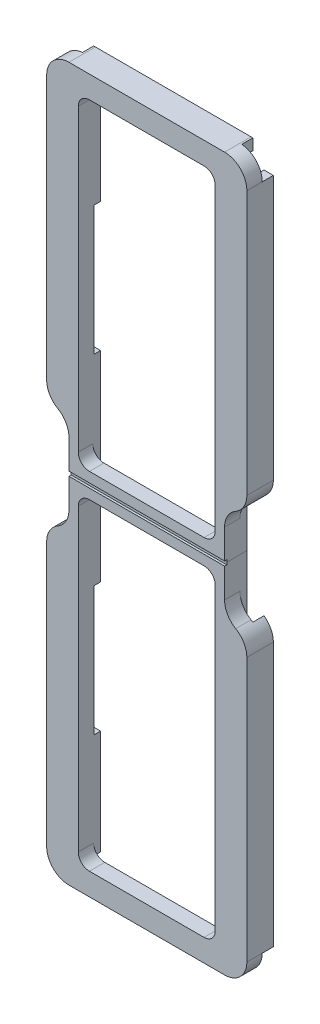
from build123d import *

# Parameters (mm, degrees)
SKETCH1_W            = 300
SKETCH1_H            = 4.2
BOSS_EXTRUDE1_DEPTH  = 5
SKETCH3_W            = 4.2
SKETCH3_H            = 58
CUT_EXTRUDE1_DEPTH   = 280.318535117
SKETCH4_W            = 2.1
SKETCH4_H            = 1.5
SKETCH4_W_2          = 1.15
SKETCH4_H_2          = 0.57
BOSS_EXTRUDE2_DEPTH  = 58
SKETCH5_W            = 4.2
SKETCH5_H            = 1.9
BOSS_EXTRUDE3_DEPTH  = 5
SKETCH6_W            = 5
SKETCH6_H            = 1.9
BOSS_EXTRUDE4_DEPTH  = 63
SKETCH7_W            = 5
SKETCH7_H            = 1.9
BOSS_EXTRUDE5_DEPTH  = 63
SKETCH8_W            = 5
SKETCH8_H            = 1.5
BOSS_EXTRUDE6_DEPTH  = 63
FILLET1_R            = 5
SKETCH9_W            = 69.9
SKETCH9_H            = 2
CUT_EXTRUDE2_DEPTH   = 1
SKETCH11_W           = 61.5
SKETCH11_H           = 147.5
BOSS_EXTRUDE8_DEPTH  = 5
SKETCH12_W           = 69.9
SKETCH12_H           = 2
BOSS_EXTRUDE9_DEPTH  = 5
SKETCH13_W           = 61.5
SKETCH13_H           = 147.5
BOSS_EXTRUDE10_DEPTH = 5
SKETCH15_W           = 125.83484861
SKETCH15_H           = 6.9
BOSS_EXTRUDE11_DEPTH = 10
SKETCH16_W           = 125.83484861
SKETCH16_H           = 6.9
BOSS_EXTRUDE12_DEPTH = 10
SKETCH17_W           = 10
SKETCH17_H           = 6.9
BOSS_EXTRUDE13_DEPTH = 5
BOSS_EXTRUDE14_REACH = 297.377
SKETCH18_W           = 4.47029548
SKETCH18_H           = 6.9
SKETCH19_W           = 10
SKETCH19_H           = 6.9
BOSS_EXTRUDE15_DEPTH = 5
SKETCH20_W           = 5
SKETCH20_H           = 6.9
BOSS_EXTRUDE16_DEPTH = 79.9
SKETCH21_W           = 89.9
SKETCH21_H           = 6.9
BOSS_EXTRUDE17_DEPTH = 5
SKETCH22_W           = 89.9
SKETCH22_H           = 6.9
BOSS_EXTRUDE18_DEPTH = 5
SKETCH23_W           = 4.2
SKETCH23_H           = 125.83484861
SKETCH23_W_2         = 71.5
SKETCH23_H_2         = 5
BOSS_EXTRUDE19_DEPTH = 5
SKETCH24_W           = 4.2
SKETCH24_H           = 125.83484861
SKETCH24_W_2         = 71.5
SKETCH24_H_2         = 5
BOSS_EXTRUDE20_DEPTH = 5
FILLET2_R            = 10
FILLET3_R            = 10
FILLET4_R            = 10
SKETCH25_W           = 61.5
SKETCH25_H           = 6.5
BOSS_EXTRUDE21_DEPTH = 3
SKETCH26_W           = 61.5
SKETCH26_H           = 6.5
BOSS_EXTRUDE22_DEPTH = 3
FILLET5_R            = 5


with BuildPart() as part:
    # Sketch1 → Boss-Extrude1 (new body)
    with BuildSketch(Plane(origin=(0, 0, 0), x_dir=(0, 1, 0), z_dir=(0, 0, 1))):
        with Locations((129.189144184, 4.775014868)):
            Rectangle(SKETCH1_W, SKETCH1_H)
    extrude(amount=BOSS_EXTRUDE1_DEPTH)

    # Sketch3 → Cut-Extrude1 (cut, through all)
    with BuildSketch(Plane.XY.offset(5)):
        with Locations((-4.775014868, 55.189144184)):
            Rectangle(SKETCH3_W, SKETCH3_H)
    extrude(amount=-CUT_EXTRUDE1_DEPTH, mode=Mode.SUBTRACT)


with BuildPart() as cut_extrude1_piece_1:
    # of the separate pieces the step leaves, piece 1, a body of its own (cut_extrude1_pieces)
    add(part.part.solids().sort_by_distance((-6.875014868, 84.189144184, 0))[0])



with BuildPart() as cut_extrude1_piece_2:
    # of the separate pieces the step leaves, piece 2, a body of its own (cut_extrude1_pieces)
    add(part.part.solids().sort_by_distance((-6.875014868, -20.810855816, 0))[0])


with BuildPart() as cut_extrude1_piece_1_1:
    add(cut_extrude1_piece_1.part)

    add(cut_extrude1_piece_2.part)  # Boss-Extrude2 merges Cut-Extrude1 piece 2
    # Sketch4 → Boss-Extrude2 (add)
    with BuildSketch(Plane.XZ.offset(-84.189144184)):
        Polygon((-5.925014868, 5), (-6.875014868, 5), (-6.875014868, 2.93), (-5.925014868, 2.93), (-5.925014868, 3.5), align=None)
        with Locations((-4.875014868, 4.25)):
            Rectangle(SKETCH4_W, SKETCH4_H)
        with Locations((-3.250014868, 4.25)):
            Rectangle(SKETCH4_W_2, SKETCH4_H)
        with Locations((-3.250014868, 3.215)):
            Rectangle(SKETCH4_W_2, SKETCH4_H_2)
    extrude(amount=BOSS_EXTRUDE2_DEPTH)

    # Split1
    split(bisect_by=Plane(origin=(0, 129.189144184, 0), x_dir=(1, 0, 0), z_dir=(0, 1, 0)), keep=Keep.BOTTOM)

    # Sketch5 → Boss-Extrude3 (add)
    with BuildSketch(Plane.XZ.offset(20.810855816)):
        with Locations((-4.775014868, 4.05)):
            Rectangle(SKETCH5_W, SKETCH5_H)
    extrude(amount=BOSS_EXTRUDE3_DEPTH)

    # Mirror1: Cut-Extrude1 piece 1 across plane


with BuildPart() as cut_extrude1_piece_1_2:
    add(cut_extrude1_piece_1_1.part)
    add(cut_extrude1_piece_1_1.part.mirror(Plane.ZX.offset(129.189144184)))


with BuildPart() as body_2:
    # Mirror4: mirrored copy
    add(cut_extrude1_piece_1_2.part.mirror(Plane.ZY.offset(-28.074985132)))


with BuildPart() as cut_extrude1_piece_1_3:
    add(cut_extrude1_piece_1_2.part)

    add(body_2.part)  # Boss-Extrude4 merges body 2
    # Sketch6 → Boss-Extrude4 (add)
    with BuildSketch(Plane.YZ.offset(-2.675014868)):
        with Locations((-23.310855816, 4.05)):
            Rectangle(SKETCH6_W, SKETCH6_H)
    extrude(amount=BOSS_EXTRUDE4_DEPTH)

    # Sketch7 → Boss-Extrude5 (add)
    with BuildSketch(Plane.YZ.offset(-2.675014868)):
        with Locations((281.689144184, 4.05)):
            Rectangle(SKETCH7_W, SKETCH7_H)
    extrude(amount=BOSS_EXTRUDE5_DEPTH)

    # Sketch8 → Boss-Extrude6 (add)
    with BuildSketch(Plane.YZ.offset(-2.675014868)):
        with Locations((129.189144184, 4.25)):
            Rectangle(SKETCH8_W, SKETCH8_H)
    extrude(amount=BOSS_EXTRUDE6_DEPTH)

    # Fillet1
    fillet1_edges = [cut_extrude1_piece_1_3.edges().sort_by_distance(p)[0] for p in [
        (63.024985132, 284.189144184, 4.05),
        (-6.875014868, -25.810855816, 4.05),
        (-6.875014868, 284.189144184, 4.05),
        (63.024985132, -25.810855816, 4.05),
    ]]
    fillet(fillet1_edges, radius=FILLET1_R)

    # Sketch9 → Cut-Extrude2 (cut)
    with BuildSketch(Plane.XY.offset(5)):
        with Locations((28.074985132, 129.189144184)):
            Rectangle(SKETCH9_W, SKETCH9_H)
    extrude(amount=-CUT_EXTRUDE2_DEPTH, mode=Mode.SUBTRACT)

    # Sketch11 → Boss-Extrude8 (add)
    with BuildSketch(Plane.XY.offset(5)):
        with BuildLine():
            Line((58.024985132, 284.189144184), (-1.875014868, 284.189144184))
            ThreePointArc((-1.875014868, 284.189144184), (-5.410548774, 282.72467809), (-6.875014868, 279.189144184))
            Line((-6.875014868, 279.189144184), (-6.875014868, 130.189144184))
            Line((-6.875014868, 130.189144184), (63.024985132, 130.189144184))
            Line((63.024985132, 130.189144184), (63.024985132, 279.189144184))
            ThreePointArc((63.024985132, 279.189144184), (61.560519038, 282.72467809), (58.024985132, 284.189144184))
        make_face()
        with Locations((28.074985132, 205.439144184)):
            Rectangle(SKETCH11_W, SKETCH11_H, mode=Mode.SUBTRACT)
    extrude(amount=BOSS_EXTRUDE8_DEPTH)

    # Sketch12 → Boss-Extrude9 (add)
    with BuildSketch(Plane.XY.offset(4)):
        with Locations((28.074985132, 129.189144184)):
            Rectangle(SKETCH12_W, SKETCH12_H)
    extrude(amount=BOSS_EXTRUDE9_DEPTH)

    # Sketch13 → Boss-Extrude10 (add)
    with BuildSketch(Plane.XY.offset(5)):
        with BuildLine():
            Line((63.024985132, -20.810855816), (63.024985132, 128.189144184))
            Line((63.024985132, 128.189144184), (-6.875014868, 128.189144184))
            Line((-6.875014868, 128.189144184), (-6.875014868, -20.810855816))
            ThreePointArc((-6.875014868, -20.810855816), (-5.410548774, -24.346389722), (-1.875014868, -25.810855816))
            Line((-1.875014868, -25.810855816), (58.024985132, -25.810855816))
            ThreePointArc((58.024985132, -25.810855816), (61.560519038, -24.346389722), (63.024985132, -20.810855816))
        make_face()
        with Locations((28.074985132, 52.939144184)):
            Rectangle(SKETCH13_W, SKETCH13_H, mode=Mode.SUBTRACT)
    extrude(amount=BOSS_EXTRUDE10_DEPTH)

    # Sketch15 → Boss-Extrude11 (add)
    with BuildSketch(Plane.YZ.offset(63.024985132)):
        with Locations((216.271719879, 6.55)):
            Rectangle(SKETCH15_W, SKETCH15_H)
        with Locations((42.106568489, 6.55)):
            Rectangle(SKETCH15_W, SKETCH15_H)
    extrude(amount=BOSS_EXTRUDE11_DEPTH)

    # Sketch16 → Boss-Extrude12 (add)
    with BuildSketch(Plane(origin=(-6.875014868, 0, 0), x_dir=(0, -1, 0), z_dir=(-1, 0, 0))):
        with Locations((-216.271719879, 6.55)):
            Rectangle(SKETCH16_W, SKETCH16_H)
        with Locations((-42.106568489, 6.55)):
            Rectangle(SKETCH16_W, SKETCH16_H)
    extrude(amount=BOSS_EXTRUDE12_DEPTH)

    # Sketch17 → Boss-Extrude13 (add)
    with BuildSketch(Plane(origin=(0, 279.189144184, 0), x_dir=(-1, 0, 0), z_dir=(0, 1, 0))):
        with Locations((11.875014868, 6.55)):
            Rectangle(SKETCH17_W, SKETCH17_H)
        with Locations((-68.024985132, 6.55)):
            Rectangle(SKETCH17_W, SKETCH17_H)
    extrude(amount=BOSS_EXTRUDE13_DEPTH)

    # Boss-Extrude14: up to this face of the body (flat: up to its plane)
    boss_extrude14_end = Plane(cut_extrude1_piece_1_3.part.faces().sort_by_distance((63.024985132, 281.689144184, 6.55))[0])
    # Sketch18 → Boss-Extrude14 (add, up to the picked face)
    with BuildSketch(Plane.YZ.offset(-6.875014868), mode=Mode.PRIVATE) as boss_extrude14_sk1:
        with Locations((281.953996444, 6.55)):
            Rectangle(SKETCH18_W, SKETCH18_H)
    boss_extrude14_tool1 = split(extrude(boss_extrude14_sk1.sketch, amount=BOSS_EXTRUDE14_REACH, mode=Mode.PRIVATE), bisect_by=boss_extrude14_end, keep=Keep.BOTH, mode=Mode.PRIVATE)
    add(boss_extrude14_tool1.solids().sort_by(Axis((-6.875015, 281.953996, 6.55), (1, 0, 0)))[0])

    # Sketch19 → Boss-Extrude15 (add)
    with BuildSketch(Plane.XZ.offset(20.810855816)):
        with Locations((68.024985132, 6.55)):
            Rectangle(SKETCH19_W, SKETCH19_H)
    extrude(amount=BOSS_EXTRUDE15_DEPTH)

    # Sketch20 → Boss-Extrude16 (add)
    with BuildSketch(Plane(origin=(63.024985132, 0, 0), x_dir=(0, -1, 0), z_dir=(-1, 0, 0))):
        with Locations((23.310855816, 6.55)):
            Rectangle(SKETCH20_W, SKETCH20_H)
    extrude(amount=BOSS_EXTRUDE16_DEPTH)

    # Sketch21 → Boss-Extrude17 (add)
    with BuildSketch(Plane.XZ.offset(25.810855816)):
        with Locations((28.074985132, 6.55)):
            Rectangle(SKETCH21_W, SKETCH21_H)
    extrude(amount=BOSS_EXTRUDE17_DEPTH)

    # Sketch22 → Boss-Extrude18 (add)
    with BuildSketch(Plane(origin=(0, 284.189144184, 0), x_dir=(-1, 0, 0), z_dir=(0, 1, 0))):
        with Locations((-28.074985132, 6.55)):
            Rectangle(SKETCH22_W, SKETCH22_H)
    extrude(amount=BOSS_EXTRUDE18_DEPTH)

    # Sketch23 → Boss-Extrude19 (add)
    with BuildSketch(Plane(origin=(0, 0, 3.1), x_dir=(1, 0, 0), z_dir=(0, 0, -1))):
        with Locations((-14.775014868, -216.271719879)):
            Rectangle(SKETCH23_W, SKETCH23_H)
        with Locations((28.074985132, -286.689144184)):
            Rectangle(SKETCH23_W_2, SKETCH23_H_2)
        with Locations((70.924985132, -216.271719879)):
            Rectangle(SKETCH23_W, SKETCH23_H)
    extrude(amount=BOSS_EXTRUDE19_DEPTH)

    # Sketch24 → Boss-Extrude20 (add)
    with BuildSketch(Plane(origin=(0, 0, 3.1), x_dir=(1, 0, 0), z_dir=(0, 0, -1))):
        with Locations((-14.775014868, -42.106568489)):
            Rectangle(SKETCH24_W, SKETCH24_H)
        with Locations((70.924985132, -42.106568489)):
            Rectangle(SKETCH24_W, SKETCH24_H)
        with Locations((28.074985132, 28.310855816)):
            Rectangle(SKETCH24_W_2, SKETCH24_H_2)
    extrude(amount=BOSS_EXTRUDE20_DEPTH)

    # Fillet2
    fillet2_edges = [cut_extrude1_piece_1_3.edges().sort_by_distance(p)[0] for p in [
        (-16.875014868, 289.189144184, 6.55),
        (73.024985132, 289.189144184, 6.55),
        (-16.875014868, -30.810855816, 6.55),
        (73.024985132, -30.810855816, 6.55),
    ]]
    fillet(fillet2_edges, radius=FILLET2_R)

    # Fillet3
    # the kernel refuses this fillet: 10 mm, written as the material it adds along each edge
    with BuildSketch(Plane(origin=(63.024985132, 105.023992794, 10), x_dir=(1, 0, 0), z_dir=(0, 0, -1))) as fillet3_piece_1_section:
        with BuildLine():
            CenterArc((FILLET3_R, -FILLET3_R), FILLET3_R, 90, 90)
            Line((0, -FILLET3_R), (0, 0))
            Line((0, 0), (FILLET3_R, 0))
        make_face()
    fillet3_piece_1 = extrude(amount=6.9, mode=Mode.PRIVATE)
    fillet3_piece_1 = split(fillet3_piece_1, bisect_by=Plane(origin=(68.824985132, 105.149733209, 6.55), z_dir=(1, 0, 0)), keep=Keep.TOP, mode=Mode.PRIVATE)
    add(fillet3_piece_1)
    with BuildSketch(Plane(origin=(63.024985132, 105.023992794, 10), x_dir=(1, 0, 0), z_dir=(0, 0, -1))) as fillet3_piece_2_section:
        with BuildLine():
            CenterArc((FILLET3_R, -FILLET3_R), FILLET3_R, 90, 90)
            Line((0, -FILLET3_R), (0, 0))
            Line((0, 0), (FILLET3_R, 0))
        make_face()
    fillet3_piece_2 = extrude(amount=6.9, mode=Mode.PRIVATE)
    fillet3_piece_2 = split(fillet3_piece_2, bisect_by=Plane(origin=(68.824985132, 107.480802197, 6.55), z_dir=(-1, 0, 0)), keep=Keep.TOP, mode=Mode.PRIVATE)
    add(fillet3_piece_2)
    with BuildSketch(Plane(origin=(63.024985132, 105.023992794, 10), x_dir=(1, 0, 0), z_dir=(0, 0, -1))) as fillet3_piece_3_section:
        with BuildLine():
            CenterArc((FILLET3_R, -FILLET3_R), FILLET3_R, 90, 90)
            Line((0, -FILLET3_R), (0, 0))
            Line((0, 0), (FILLET3_R, 0))
        make_face()
    fillet3_piece_3 = extrude(amount=31.9, mode=Mode.PRIVATE)
    fillet3_piece_3 = split(fillet3_piece_3, bisect_by=Plane(origin=(70.287056522, 105.149733209, 3.1), z_dir=(0, 0, -1)), keep=Keep.TOP, mode=Mode.PRIVATE)
    fillet3_piece_3 = split(fillet3_piece_3, bisect_by=Plane(origin=(68.824985132, 105.149733209, 1.55), z_dir=(1, 0, 0)), keep=Keep.TOP, mode=Mode.PRIVATE)
    fillet3_piece_3 = split(fillet3_piece_3, bisect_by=Plane(origin=(70.287056522, 105.149733209, 0), z_dir=(0, 0, 1)), keep=Keep.TOP, mode=Mode.PRIVATE)
    add(fillet3_piece_3)
    with BuildSketch(Plane(origin=(63.024985132, 105.023992794, 10), x_dir=(1, 0, 0), z_dir=(0, 0, -1))) as fillet3_piece_4_section:
        with BuildLine():
            CenterArc((FILLET3_R, -FILLET3_R), FILLET3_R, 90, 90)
            Line((0, -FILLET3_R), (0, 0))
            Line((0, 0), (FILLET3_R, 0))
        make_face()
    fillet3_piece_4 = extrude(amount=31.9, mode=Mode.PRIVATE)
    fillet3_piece_4 = split(fillet3_piece_4, bisect_by=Plane(origin=(68.824985132, 105.149733209, -0.95), z_dir=(1, 0, 0)), keep=Keep.TOP, mode=Mode.PRIVATE)
    fillet3_piece_4 = split(fillet3_piece_4, bisect_by=Plane(origin=(70.287056522, 105.149733209, -1.9), z_dir=(0, 0, 1)), keep=Keep.TOP, mode=Mode.PRIVATE)
    fillet3_piece_4 = split(fillet3_piece_4, bisect_by=Plane(origin=(70.287056522, 105.149733209, 0), z_dir=(0, 0, -1)), keep=Keep.TOP, mode=Mode.PRIVATE)
    add(fillet3_piece_4)
    with BuildSketch(Plane(origin=(63.024985132, 153.354295574, 10), x_dir=(0, -1, 0), z_dir=(0, 0, -1))) as fillet3_piece_5_section:
        with BuildLine():
            CenterArc((FILLET3_R, -FILLET3_R), FILLET3_R, 90, 90)
            Line((0, -FILLET3_R), (0, 0))
            Line((0, 0), (FILLET3_R, 0))
        make_face()
    fillet3_piece_5 = extrude(amount=6.9, mode=Mode.PRIVATE)
    fillet3_piece_5 = split(fillet3_piece_5, bisect_by=Plane(origin=(68.824985132, 150.897486171, 6.55), z_dir=(-1, 0, 0)), keep=Keep.TOP, mode=Mode.PRIVATE)
    add(fillet3_piece_5)
    with BuildSketch(Plane(origin=(63.024985132, 153.354295574, 10), x_dir=(0, -1, 0), z_dir=(0, 0, -1))) as fillet3_piece_6_section:
        with BuildLine():
            CenterArc((FILLET3_R, -FILLET3_R), FILLET3_R, 90, 90)
            Line((0, -FILLET3_R), (0, 0))
            Line((0, 0), (FILLET3_R, 0))
        make_face()
    fillet3_piece_6 = extrude(amount=6.9, mode=Mode.PRIVATE)
    fillet3_piece_6 = split(fillet3_piece_6, bisect_by=Plane(origin=(68.824985132, 153.22855516, 6.55), z_dir=(1, 0, 0)), keep=Keep.TOP, mode=Mode.PRIVATE)
    add(fillet3_piece_6)
    with BuildSketch(Plane(origin=(63.024985132, 153.354295574, 10), x_dir=(0, -1, 0), z_dir=(0, 0, -1))) as fillet3_piece_7_section:
        with BuildLine():
            CenterArc((FILLET3_R, -FILLET3_R), FILLET3_R, 90, 90)
            Line((0, -FILLET3_R), (0, 0))
            Line((0, 0), (FILLET3_R, 0))
        make_face()
    fillet3_piece_7 = extrude(amount=31.9, mode=Mode.PRIVATE)
    fillet3_piece_7 = split(fillet3_piece_7, bisect_by=Plane(origin=(70.287056522, 153.22855516, 0), z_dir=(0, 0, 1)), keep=Keep.TOP, mode=Mode.PRIVATE)
    fillet3_piece_7 = split(fillet3_piece_7, bisect_by=Plane(origin=(70.287056522, 153.22855516, 3.1), z_dir=(0, 0, -1)), keep=Keep.TOP, mode=Mode.PRIVATE)
    fillet3_piece_7 = split(fillet3_piece_7, bisect_by=Plane(origin=(68.824985132, 153.22855516, 1.55), z_dir=(1, 0, 0)), keep=Keep.TOP, mode=Mode.PRIVATE)
    add(fillet3_piece_7)
    with BuildSketch(Plane(origin=(63.024985132, 153.354295574, 10), x_dir=(0, -1, 0), z_dir=(0, 0, -1))) as fillet3_piece_8_section:
        with BuildLine():
            CenterArc((FILLET3_R, -FILLET3_R), FILLET3_R, 90, 90)
            Line((0, -FILLET3_R), (0, 0))
            Line((0, 0), (FILLET3_R, 0))
        make_face()
    fillet3_piece_8 = extrude(amount=31.9, mode=Mode.PRIVATE)
    fillet3_piece_8 = split(fillet3_piece_8, bisect_by=Plane(origin=(70.287056522, 153.22855516, 0), z_dir=(0, 0, -1)), keep=Keep.TOP, mode=Mode.PRIVATE)
    fillet3_piece_8 = split(fillet3_piece_8, bisect_by=Plane(origin=(70.287056522, 153.22855516, -1.9), z_dir=(0, 0, 1)), keep=Keep.TOP, mode=Mode.PRIVATE)
    fillet3_piece_8 = split(fillet3_piece_8, bisect_by=Plane(origin=(68.824985132, 153.22855516, -0.95), z_dir=(1, 0, 0)), keep=Keep.TOP, mode=Mode.PRIVATE)
    add(fillet3_piece_8)
    with BuildSketch(Plane(origin=(-6.875014868, 153.354295574, 10), x_dir=(0, -1, 0), z_dir=(0, 0, -1))) as fillet3_piece_9_section:
        with BuildLine():
            CenterArc((FILLET3_R, FILLET3_R), FILLET3_R, 180, 90)
            Line((0, FILLET3_R), (0, 0))
            Line((0, 0), (FILLET3_R, 0))
        make_face()
    fillet3_piece_9 = extrude(amount=6.9, mode=Mode.PRIVATE)
    fillet3_piece_9 = split(fillet3_piece_9, bisect_by=Plane(origin=(-12.675014868, 150.897486171, 6.55), z_dir=(1, 0, 0)), keep=Keep.TOP, mode=Mode.PRIVATE)
    add(fillet3_piece_9)
    with BuildSketch(Plane(origin=(-6.875014868, 153.354295574, 10), x_dir=(0, -1, 0), z_dir=(0, 0, -1))) as fillet3_piece_10_section:
        with BuildLine():
            CenterArc((FILLET3_R, FILLET3_R), FILLET3_R, 180, 90)
            Line((0, FILLET3_R), (0, 0))
            Line((0, 0), (FILLET3_R, 0))
        make_face()
    fillet3_piece_10 = extrude(amount=6.9, mode=Mode.PRIVATE)
    fillet3_piece_10 = split(fillet3_piece_10, bisect_by=Plane(origin=(-12.675014868, 153.22855516, 6.55), z_dir=(-1, 0, 0)), keep=Keep.TOP, mode=Mode.PRIVATE)
    add(fillet3_piece_10)
    with BuildSketch(Plane(origin=(-6.875014868, 153.354295574, 10), x_dir=(0, -1, 0), z_dir=(0, 0, -1))) as fillet3_piece_11_section:
        with BuildLine():
            CenterArc((FILLET3_R, FILLET3_R), FILLET3_R, 180, 90)
            Line((0, FILLET3_R), (0, 0))
            Line((0, 0), (FILLET3_R, 0))
        make_face()
    fillet3_piece_11 = extrude(amount=31.9, mode=Mode.PRIVATE)
    fillet3_piece_11 = split(fillet3_piece_11, bisect_by=Plane(origin=(-14.137086257, 153.22855516, 0), z_dir=(0, 0, 1)), keep=Keep.TOP, mode=Mode.PRIVATE)
    fillet3_piece_11 = split(fillet3_piece_11, bisect_by=Plane(origin=(-14.137086257, 153.22855516, 3.1), z_dir=(0, 0, -1)), keep=Keep.TOP, mode=Mode.PRIVATE)
    fillet3_piece_11 = split(fillet3_piece_11, bisect_by=Plane(origin=(-12.675014868, 153.22855516, 1.55), z_dir=(-1, 0, 0)), keep=Keep.TOP, mode=Mode.PRIVATE)
    add(fillet3_piece_11)
    with BuildSketch(Plane(origin=(-6.875014868, 153.354295574, 10), x_dir=(0, -1, 0), z_dir=(0, 0, -1))) as fillet3_piece_12_section:
        with BuildLine():
            CenterArc((FILLET3_R, FILLET3_R), FILLET3_R, 180, 90)
            Line((0, FILLET3_R), (0, 0))
            Line((0, 0), (FILLET3_R, 0))
        make_face()
    fillet3_piece_12 = extrude(amount=31.9, mode=Mode.PRIVATE)
    fillet3_piece_12 = split(fillet3_piece_12, bisect_by=Plane(origin=(-14.137086257, 153.22855516, 0), z_dir=(0, 0, -1)), keep=Keep.TOP, mode=Mode.PRIVATE)
    fillet3_piece_12 = split(fillet3_piece_12, bisect_by=Plane(origin=(-14.137086257, 153.22855516, -1.9), z_dir=(0, 0, 1)), keep=Keep.TOP, mode=Mode.PRIVATE)
    fillet3_piece_12 = split(fillet3_piece_12, bisect_by=Plane(origin=(-12.675014868, 153.22855516, -0.95), z_dir=(-1, 0, 0)), keep=Keep.TOP, mode=Mode.PRIVATE)
    add(fillet3_piece_12)
    with BuildSketch(Plane(origin=(-6.875014868, 105.023992794, -21.9), x_dir=(-1, 0, 0), z_dir=(0, 0, 1))) as fillet3_piece_13_section:
        with BuildLine():
            CenterArc((FILLET3_R, -FILLET3_R), FILLET3_R, 90, 90)
            Line((0, -FILLET3_R), (0, 0))
            Line((0, 0), (FILLET3_R, 0))
        make_face()
    fillet3_piece_13 = extrude(amount=31.9, mode=Mode.PRIVATE)
    fillet3_piece_13 = split(fillet3_piece_13, bisect_by=Plane(origin=(-12.675014868, 105.149733209, -0.95), z_dir=(-1, 0, 0)), keep=Keep.TOP, mode=Mode.PRIVATE)
    fillet3_piece_13 = split(fillet3_piece_13, bisect_by=Plane(origin=(-14.137086257, 105.149733209, -1.9), z_dir=(0, 0, 1)), keep=Keep.TOP, mode=Mode.PRIVATE)
    fillet3_piece_13 = split(fillet3_piece_13, bisect_by=Plane(origin=(-14.137086257, 105.149733209, 0), z_dir=(0, 0, -1)), keep=Keep.TOP, mode=Mode.PRIVATE)
    add(fillet3_piece_13)
    with BuildSketch(Plane(origin=(-6.875014868, 105.023992794, -21.9), x_dir=(-1, 0, 0), z_dir=(0, 0, 1))) as fillet3_piece_14_section:
        with BuildLine():
            CenterArc((FILLET3_R, -FILLET3_R), FILLET3_R, 90, 90)
            Line((0, -FILLET3_R), (0, 0))
            Line((0, 0), (FILLET3_R, 0))
        make_face()
    fillet3_piece_14 = extrude(amount=31.9, mode=Mode.PRIVATE)
    fillet3_piece_14 = split(fillet3_piece_14, bisect_by=Plane(origin=(-14.137086257, 105.149733209, 3.1), z_dir=(0, 0, -1)), keep=Keep.TOP, mode=Mode.PRIVATE)
    fillet3_piece_14 = split(fillet3_piece_14, bisect_by=Plane(origin=(-12.675014868, 105.149733209, 1.55), z_dir=(-1, 0, 0)), keep=Keep.TOP, mode=Mode.PRIVATE)
    fillet3_piece_14 = split(fillet3_piece_14, bisect_by=Plane(origin=(-14.137086257, 105.149733209, 0), z_dir=(0, 0, 1)), keep=Keep.TOP, mode=Mode.PRIVATE)
    add(fillet3_piece_14)
    with BuildSketch(Plane(origin=(-6.875014868, 105.023992794, 3.1), x_dir=(-1, 0, 0), z_dir=(0, 0, 1))) as fillet3_piece_15_section:
        with BuildLine():
            CenterArc((FILLET3_R, -FILLET3_R), FILLET3_R, 90, 90)
            Line((0, -FILLET3_R), (0, 0))
            Line((0, 0), (FILLET3_R, 0))
        make_face()
    fillet3_piece_15 = extrude(amount=6.9, mode=Mode.PRIVATE)
    fillet3_piece_15 = split(fillet3_piece_15, bisect_by=Plane(origin=(-12.675014868, 105.149733209, 6.55), z_dir=(-1, 0, 0)), keep=Keep.TOP, mode=Mode.PRIVATE)
    add(fillet3_piece_15)
    with BuildSketch(Plane(origin=(-6.875014868, 105.023992794, 3.1), x_dir=(-1, 0, 0), z_dir=(0, 0, 1))) as fillet3_piece_16_section:
        with BuildLine():
            CenterArc((FILLET3_R, -FILLET3_R), FILLET3_R, 90, 90)
            Line((0, -FILLET3_R), (0, 0))
            Line((0, 0), (FILLET3_R, 0))
        make_face()
    fillet3_piece_16 = extrude(amount=6.9, mode=Mode.PRIVATE)
    fillet3_piece_16 = split(fillet3_piece_16, bisect_by=Plane(origin=(-12.675014868, 107.480802197, 6.55), z_dir=(1, 0, 0)), keep=Keep.TOP, mode=Mode.PRIVATE)
    add(fillet3_piece_16)

    # Fillet4
    fillet4_edges = [cut_extrude1_piece_1_3.edges().sort_by_distance(p)[0] for p in [
        (73.024985132, 105.023992794, 4.05),
        (73.024985132, 153.354295574, 4.05),
        (-16.875014868, 153.354295574, 4.05),
        (-16.875014868, 105.023992794, 4.05),
    ]]
    fillet(fillet4_edges, radius=FILLET4_R)

    # Sketch25 → Boss-Extrude21 (add)
    with BuildSketch(Plane.XZ.offset(-126.689144184)):
        with Locations((28.074985132, 6.75)):
            Rectangle(SKETCH25_W, SKETCH25_H)
    extrude(amount=BOSS_EXTRUDE21_DEPTH)

    # Sketch26 → Boss-Extrude22 (add)
    with BuildSketch(Plane(origin=(0, 131.689144184, 0), x_dir=(-1, 0, 0), z_dir=(0, 1, 0))):
        with Locations((-28.074985132, 6.75)):
            Rectangle(SKETCH26_W, SKETCH26_H)
    extrude(amount=BOSS_EXTRUDE22_DEPTH)

    # Fillet5
    fillet5_edges = [cut_extrude1_piece_1_3.edges().sort_by_distance(p)[0] for p in [
        (58.824985132, 279.189144184, 6.55),
        (-2.675014868, 279.189144184, 6.55),
        (-2.675014868, 123.689144184, 6.75),
        (58.824985132, 123.689144184, 6.75),
        (58.824985132, 134.689144184, 6.75),
        (-2.675014868, 134.689144184, 6.75),
        (-2.675014868, -20.810855816, 6.55),
        (58.824985132, -20.810855816, 6.55),
    ]]
    fillet(fillet5_edges, radius=FILLET5_R)


with BuildPart() as body_2_2:
    # Split2: the piece on the far side of the plane
    add(cut_extrude1_piece_1_3.part)
    split(bisect_by=Plane(origin=(0, 129.189144184, 0), x_dir=(0, 0, -1), z_dir=(0, -1, 0)), keep=Keep.BOTTOM)


with BuildPart() as cut_extrude1_piece_1_4:
    add(cut_extrude1_piece_1_3.part)

    # Split2
    split(bisect_by=Plane(origin=(0, 129.189144184, 0), x_dir=(0, 0, -1), z_dir=(0, -1, 0)), keep=Keep.TOP)


solid = Compound([body_2_2.part, cut_extrude1_piece_1_4.part])
